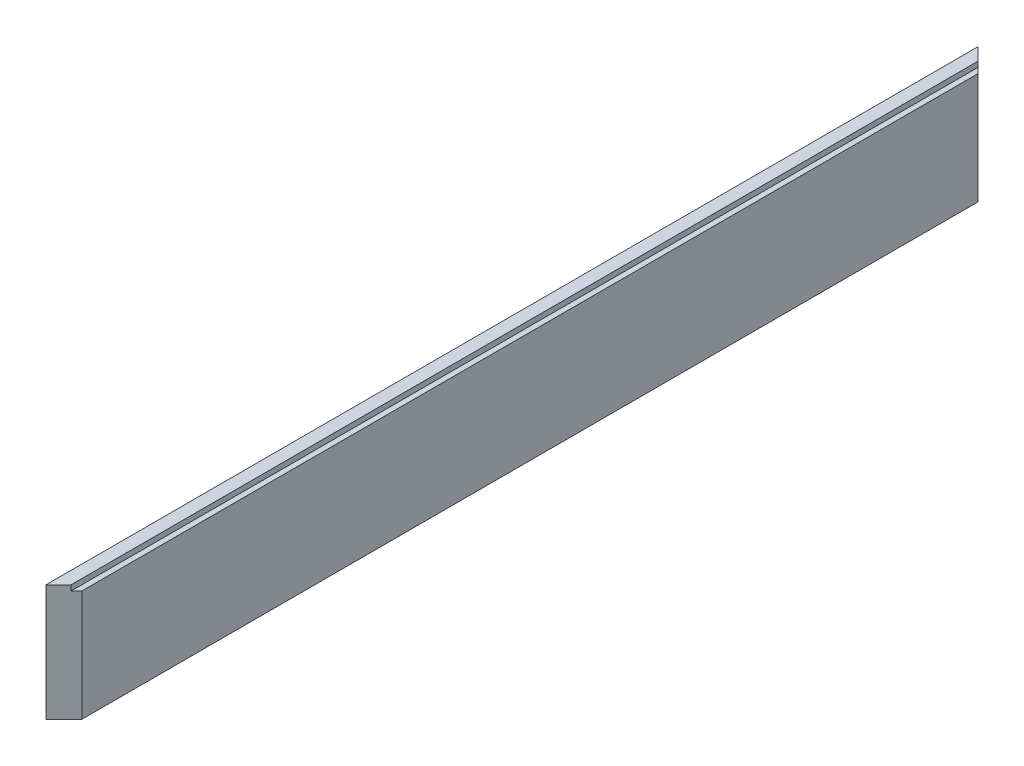
from build123d import *

# Parameters (mm, degrees)
ESQUISSE1_W             = 10
ESQUISSE1_H             = 65
BOSS_EXTRU_1_DEPTH      = 520
CHANFREIN1_SIZE         = 10
ESQUISSE2_W             = 3
ESQUISSE2_H             = 3
ENL_V_MAT_EXTRU_1_DEPTH = 525.14215629


with BuildPart() as part:
    # Esquisse1 → Boss.-Extru.1 (new body)
    with BuildSketch(Plane.XY):
        with Locations((5, 32.5)):
            Rectangle(ESQUISSE1_W, ESQUISSE1_H)
    extrude(amount=BOSS_EXTRU_1_DEPTH)

    # Chanfrein1
    chanfrein1_edges = [part.edges().sort_by_distance(p)[0] for p in [
        (10, 32.5, 520),
        (10, 32.5, 0),
    ]]
    chamfer(chanfrein1_edges, length=CHANFREIN1_SIZE - 0.0001)  # a hair under: the kernel refuses the full size

    # Esquisse2 → Enlèv. mat.-Extru.1 (cut, through all)
    with BuildSketch(Plane.XY):
        with Locations((8.5, 63.5)):
            Rectangle(ESQUISSE2_W, ESQUISSE2_H)
    extrude(amount=ENL_V_MAT_EXTRU_1_DEPTH, mode=Mode.SUBTRACT)


solid = part.part
